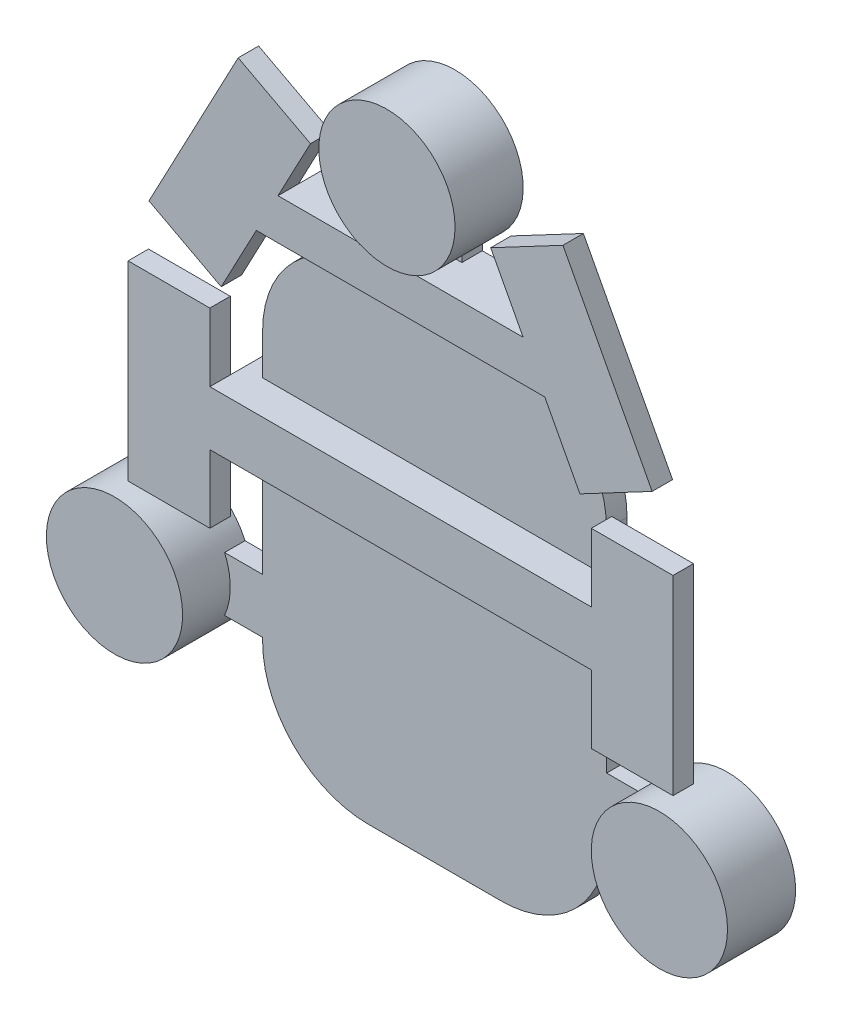
from build123d import *

# Parameters (mm, degrees)
BOSS_EXTRU_1_DEPTH      = 3
ESQUISSE2_R             = 10
BOSS_EXTRU_2_DEPTH      = 7
BOSS_EXTRU_3_DEPTH      = 5
ESQUISSE4_W             = 12
ESQUISSE4_H             = 28
ENL_V_MAT_EXTRU_1_DEPTH = 5


# Read off the part's stored shape, not the designer's step: Boss.-Extru.1
with BuildPart() as part:
    # Boss.-Extru.1 outline → Boss.-Extru.1 (new body)
    with BuildSketch(Plane.XY):
        with BuildLine():
            ThreePointArc((-25.25, -4.5), (-20.710155108, -15.460155108), (-9.75, -20))
            Line((-9.75, -20), (9.75, -20))
            ThreePointArc((9.75, -20), (20.710155108, -15.460155108), (25.25, -4.5))
            Line((25.25, -4.5), (25.25, -4))
            Line((25.25, -4), (30.83484861, -4))
            ThreePointArc((30.83484861, -4), (50, 0), (30.83484861, 4))
            Line((30.83484861, 4), (25.25, 4))
            Line((25.25, 4), (25.25, 21))
            Line((25.25, 21), (28, 21))
            Line((28, 21), (28, 11))
            Line((28, 11), (40, 11))
            Line((40, 11), (40, 39))
            Line((40, 39), (28, 39))
            Line((28, 39), (28, 29))
            Line((28, 29), (25.25, 29))
            Line((25.25, 29), (25.25, 35))
            ThreePointArc((25.25, 35), (20.710155108, 45.960155108), (9.75, 50.5))
            Line((9.75, 50.5), (4, 50.5))
            Line((4, 50.5), (4, 52.282032303))
            Line((4, 52.282032303), (21.172408726, 52.282032303))
            Line((21.172408726, 52.282032303), (26.332088428, 42.535970645))
            Line((26.332088428, 42.535970645), (36.937543424, 48.15062329))
            Line((36.937543424, 48.15062329), (23.836687252, 72.896684948))
            Line((23.836687252, 72.896684948), (13.231232256, 67.282032303))
            Line((13.231232256, 67.282032303), (17.995938138, 58.282032303))
            Line((17.995938138, 58.282032303), (4, 58.282032303))
            Line((4, 58.282032303), (4, 60.116880913))
            ThreePointArc((4, 60.116880913), (0, 79.282032303), (-4, 60.116880913))
            Line((-4, 60.116880913), (-4, 58.282032303))
            Line((-4, 58.282032303), (-17.995938138, 58.282032303))
            Line((-17.995938138, 58.282032303), (-13.231232256, 67.282032303))
            Line((-13.231232256, 67.282032303), (-23.836687252, 72.896684948))
            Line((-23.836687252, 72.896684948), (-36.937543424, 48.15062329))
            Line((-36.937543424, 48.15062329), (-26.332088428, 42.535970645))
            Line((-26.332088428, 42.535970645), (-21.172408726, 52.282032303))
            Line((-21.172408726, 52.282032303), (-4, 52.282032303))
            Line((-4, 52.282032303), (-4, 50.5))
            Line((-4, 50.5), (-9.75, 50.5))
            ThreePointArc((-9.75, 50.5), (-20.710155108, 45.960155108), (-25.25, 35))
            Line((-25.25, 35), (-25.25, 29))
            Line((-25.25, 29), (-28, 29))
            Line((-28, 29), (-28, 39))
            Line((-28, 39), (-40, 39))
            Line((-40, 39), (-40, 11))
            Line((-40, 11), (-28, 11))
            Line((-28, 11), (-28, 21))
            Line((-28, 21), (-25.25, 21))
            Line((-25.25, 21), (-25.25, 4))
            Line((-25.25, 4), (-30.83484861, 4))
            ThreePointArc((-30.83484861, 4), (-50, 0), (-30.83484861, -4))
            Line((-30.83484861, -4), (-25.25, -4))
            Line((-25.25, -4), (-25.25, -4.5))
        make_face()
    extrude(amount=BOSS_EXTRU_1_DEPTH)

    # Esquisse2 → Boss.-Extru.2 (add)
    with BuildSketch(Plane.XY.offset(3)):
        with Locations(Location((-40, 0, 0), (0, 0, 336.421821522))):
            Circle(ESQUISSE2_R)
        with Locations(Location((40, 0, 0), (0, 0, 156.421821522))):
            Circle(ESQUISSE2_R)
        with Locations(Location((0, 69.282032303, 0), (0, 0, 246.421821522))):
            Circle(ESQUISSE2_R)
    extrude(amount=BOSS_EXTRU_2_DEPTH)

    # Esquisse3 → Boss.-Extru.3 (add)
    with BuildSketch(Plane.XY.offset(3)):
        Polygon((23.836687252, 72.896684948), (36.937543424, 48.15062329), (26.332088428, 42.535970645), (21.172408726, 52.282032303), (-21.172408726, 52.282032303), (-26.332088428, 42.535970645), (-36.937543424, 48.15062329), (-23.836687252, 72.896684948), (-13.231232256, 67.282032303), (-17.995938138, 58.282032303), (17.995938138, 58.282032303), (13.231232256, 67.282032303), align=None)
        Polygon((28, 39), (40, 39), (40, 11), (28, 11), (28, 21), (-28, 21), (-28, 11), (-40, 11), (-40, 39), (-28, 39), (-28, 29), (28, 29), align=None)
    extrude(amount=BOSS_EXTRU_3_DEPTH)

    # Esquisse4 → Enlèv. mat.-Extru.1 (cut)
    with BuildSketch(Plane(origin=(0, 0, 0), x_dir=(-1, 0, 0), z_dir=(0, 0, -1))):
        with Locations((-34, 25)):
            Rectangle(ESQUISSE4_W, ESQUISSE4_H)
        Polygon((-36.937543424, 48.15062329), (-26.332088428, 42.535970645), (-13.231232256, 67.282032303), (-23.836687252, 72.896684948), align=None)
        Polygon((13.231232256, 67.282032303), (23.836687252, 72.896684948), (36.937543424, 48.15062329), (26.332088428, 42.535970645), align=None)
        with Locations((34, 25)):
            Rectangle(ESQUISSE4_W, ESQUISSE4_H)
    extrude(amount=-ENL_V_MAT_EXTRU_1_DEPTH, mode=Mode.SUBTRACT)


solid = part.part
